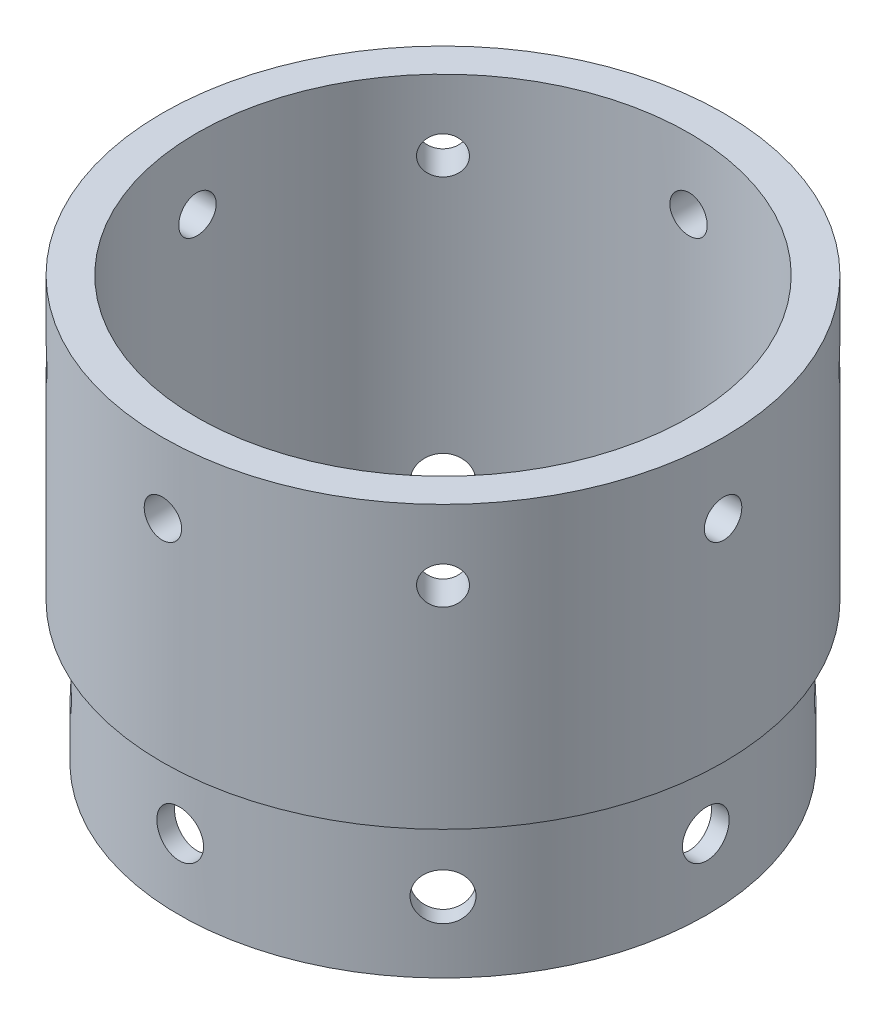
from build123d import *

# Parameters (mm, degrees)
CIRPATTERN1_COUNT = 8


with BuildPart() as part:
    # Sketch1 → Revolve1 (revolve)
    with BuildSketch(Plane.XY):
        Polygon((47.625, 0), (47.625, 25.4), (50.673, 25.4), (50.673, 76.2), (44.45, 76.2), (44.45, 0), align=None)
    revolve(axis=Axis((0, 77.848391372, 0), (0, -1, 0)))

    # Sketch4 → 5/16 Clearance Hole1 (revolve, cut)
    with BuildSketch(Plane(origin=(0, 12.7, 50.673), x_dir=(0, -1, 0), z_dir=(1, 0, 0))):
        Polygon((0, 0), (0, 19.304), (4.2164, 16.770531286), (4.2164, 0), align=None)
    f_5_16_clearance_hole1 = revolve(axis=Axis((0, 12.7, 57.023), (0, 0, -1)), mode=Mode.SUBTRACT)

    # Sketch5 → 1/4 Clearance Hole1 (revolve, cut)
    with BuildSketch(Plane(origin=(0, 63.5, 50.673), x_dir=(0, -1, 0), z_dir=(1, 0, 0))):
        Polygon((0, 0), (0, 16.51), (3.3782, 14.480172657), (3.3782, 0), align=None)
    f_1_4_clearance_hole1 = revolve(axis=Axis((0, 63.5, 57.023), (0, 0, -1)), mode=Mode.SUBTRACT)

    # CirPattern1: 5/16 Clearance Hole1, 1/4 Clearance Hole1 ×8 about axis
    cirpattern1_axis = Axis((0, 77.848391372, 0), (0, 1, 0))
    add([f_5_16_clearance_hole1.rotate(cirpattern1_axis, i * 360 / CIRPATTERN1_COUNT) for i in range(1, CIRPATTERN1_COUNT)], mode=Mode.SUBTRACT)
    add([f_1_4_clearance_hole1.rotate(cirpattern1_axis, i * 360 / CIRPATTERN1_COUNT) for i in range(1, CIRPATTERN1_COUNT)], mode=Mode.SUBTRACT)


solid = part.part
